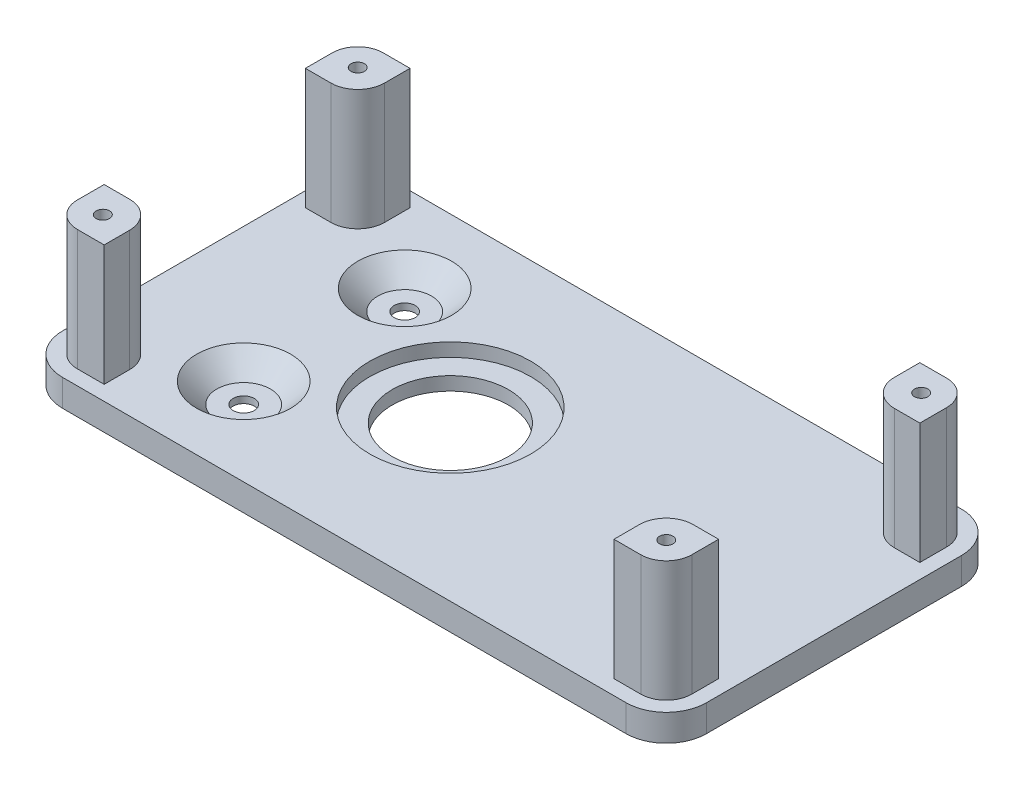
from build123d import *

# Parameters (mm, degrees)
SKETCH1_W           = 121.92
SKETCH1_H           = 63.5
BOSS_EXTRUDE1_DEPTH = 5.08
FILLET1_R           = 7.62
SKETCH2_W           = 9.906
SKETCH2_H           = 9.906
BOSS_EXTRUDE2_DEPTH = 22.86
FILLET2_R           = 4.826
FILLET3_R           = 5.08
SKETCH3_R           = 1.27
CUT_EXTRUDE1_DEPTH  = 22.86
CUT_EXTRUDE2_REACH  = 142.276
SKETCH5_R           = 10.9982
CUT_EXTRUDE3_REACH  = 142.276
SKETCH6_R           = 1.9939
SKETCH7_R           = 5.08
CUT_EXTRUDE4_DEPTH  = 3.81
CHAMFER1_SIZE       = 3.81
SKETCH8_R           = 15.24
CUT_EXTRUDE5_DEPTH  = 2.54


with BuildPart() as part:
    # Sketch1 → Boss-Extrude1 (new body)
    with BuildSketch(Plane(origin=(0, 0, 0), x_dir=(1, 0, 0), z_dir=(0, 1, 0))):
        with Locations((60.96, 31.75)):
            Rectangle(SKETCH1_W, SKETCH1_H)
    extrude(amount=BOSS_EXTRUDE1_DEPTH)

    # Fillet1
    fillet1_edges = [part.edges().sort_by_distance(p)[0] for p in [
        (0, 2.54, -63.5),
        (121.92, 2.54, -63.5),
        (121.92, 2.54, 0),
        (0, 2.54, 0),
    ]]
    fillet(fillet1_edges, radius=FILLET1_R)

    # Sketch2 → Boss-Extrude2 (add)
    with BuildSketch(Plane(origin=(0, 5.08, 0), x_dir=(1, 0, 0), z_dir=(0, 1, 0))):
        with Locations((7.747, 55.753)):
            Rectangle(SKETCH2_W, SKETCH2_H)
        with Locations((114.173, 55.753)):
            Rectangle(SKETCH2_W, SKETCH2_H)
        with Locations((114.173, 7.747)):
            Rectangle(SKETCH2_W, SKETCH2_H)
        with Locations((7.747, 7.747)):
            Rectangle(SKETCH2_W, SKETCH2_H)
    extrude(amount=BOSS_EXTRUDE2_DEPTH)

    # Fillet2
    fillet2_edges = [part.edges().sort_by_distance(p)[0] for p in [
        (2.794, 16.51, -60.706),
        (119.126, 16.51, -60.706),
        (119.126, 16.51, -2.794),
        (2.794, 16.51, -2.794),
    ]]
    fillet(fillet2_edges, radius=FILLET2_R)

    # Fillet3
    fillet3_edges = [part.edges().sort_by_distance(p)[0] for p in [
        (12.7, 16.51, -50.8),
        (109.22, 16.51, -50.8),
        (109.22, 16.51, -12.7),
        (12.7, 16.51, -12.7),
    ]]
    fillet(fillet3_edges, radius=FILLET3_R)

    # Sketch3 → Cut-Extrude1 (cut)
    with BuildSketch(Plane(origin=(0, 27.94, 0), x_dir=(1, 0, 0), z_dir=(0, 1, 0))):
        with Locations(Location((7.62, 55.88, 0), (0, 0, 270))):
            Circle(SKETCH3_R)
        with Locations(Location((114.3, 55.88, 0), (0, 0, 270))):
            Circle(SKETCH3_R)
        with Locations(Location((114.3, 7.62, 0), (0, 0, 270))):
            Circle(SKETCH3_R)
        with Locations(Location((7.62, 7.62, 0), (0, 0, 270))):
            Circle(SKETCH3_R)
    extrude(amount=-CUT_EXTRUDE1_DEPTH, mode=Mode.SUBTRACT)

    # Sketch5 → Cut-Extrude2 (cut, up to next)
    with BuildSketch(Plane.XZ, mode=Mode.PRIVATE) as cut_extrude2_sk1:
        with Locations(Location((49.276, -31.75, 0), (0, 0, 270))):
            Circle(SKETCH5_R)
    cut_extrude2_tool1 = extrude(cut_extrude2_sk1.sketch, amount=-CUT_EXTRUDE2_REACH, mode=Mode.PRIVATE) & part.part
    add(cut_extrude2_tool1.solids().sort_by_distance((49.276, 0, -31.75))[0], mode=Mode.SUBTRACT)

    # Sketch6 → Cut-Extrude3 (cut, up to next)
    with BuildSketch(Plane.XZ, mode=Mode.PRIVATE) as cut_extrude3_sk1:
        with Locations(Location((25.4, -16.51, 0), (0, 0, 270))):
            Circle(SKETCH6_R)
    cut_extrude3_tool1 = extrude(cut_extrude3_sk1.sketch, amount=-CUT_EXTRUDE3_REACH, mode=Mode.PRIVATE) & part.part
    # Sketch6 → Cut-Extrude3 (cut, up to next)
    with BuildSketch(Plane.XZ, mode=Mode.PRIVATE) as cut_extrude3_sk2:
        with Locations(Location((25.4, -46.99, 0), (0, 0, 270))):
            Circle(SKETCH6_R)
    cut_extrude3_tool2 = extrude(cut_extrude3_sk2.sketch, amount=-CUT_EXTRUDE3_REACH, mode=Mode.PRIVATE) & part.part
    add(cut_extrude3_tool1.solids().sort_by_distance((25.4, 0, -16.51))[0], mode=Mode.SUBTRACT)
    add(cut_extrude3_tool2.solids().sort_by_distance((25.4, 0, -46.99))[0], mode=Mode.SUBTRACT)

    # Sketch7 → Cut-Extrude4 (cut)
    with BuildSketch(Plane(origin=(0, 5.08, 0), x_dir=(1, 0, 0), z_dir=(0, 1, 0))):
        with Locations(Location((25.4, 46.99, 0), (0, 0, 270))):
            Circle(SKETCH7_R)
        with Locations(Location((25.4, 16.51, 0), (0, 0, 270))):
            Circle(SKETCH7_R)
    extrude(amount=-CUT_EXTRUDE4_DEPTH, mode=Mode.SUBTRACT)

    # Chamfer1
    chamfer1_edges = [part.edges().sort_by_distance(p)[0] for p in [
        (25.4, 5.08, -52.07),
        (25.4, 5.08, -21.59),
    ]]
    chamfer(chamfer1_edges, length=CHAMFER1_SIZE - 0.0001)  # a hair under: the kernel refuses the full size

    # Sketch8 → Cut-Extrude5 (cut)
    with BuildSketch(Plane(origin=(0, 5.08, 0), x_dir=(1, 0, 0), z_dir=(0, 1, 0))):
        with Locations(Location((49.276, 31.75, 0), (0, 0, 270))):
            Circle(SKETCH8_R)
    extrude(amount=-CUT_EXTRUDE5_DEPTH, mode=Mode.SUBTRACT)


solid = part.part
